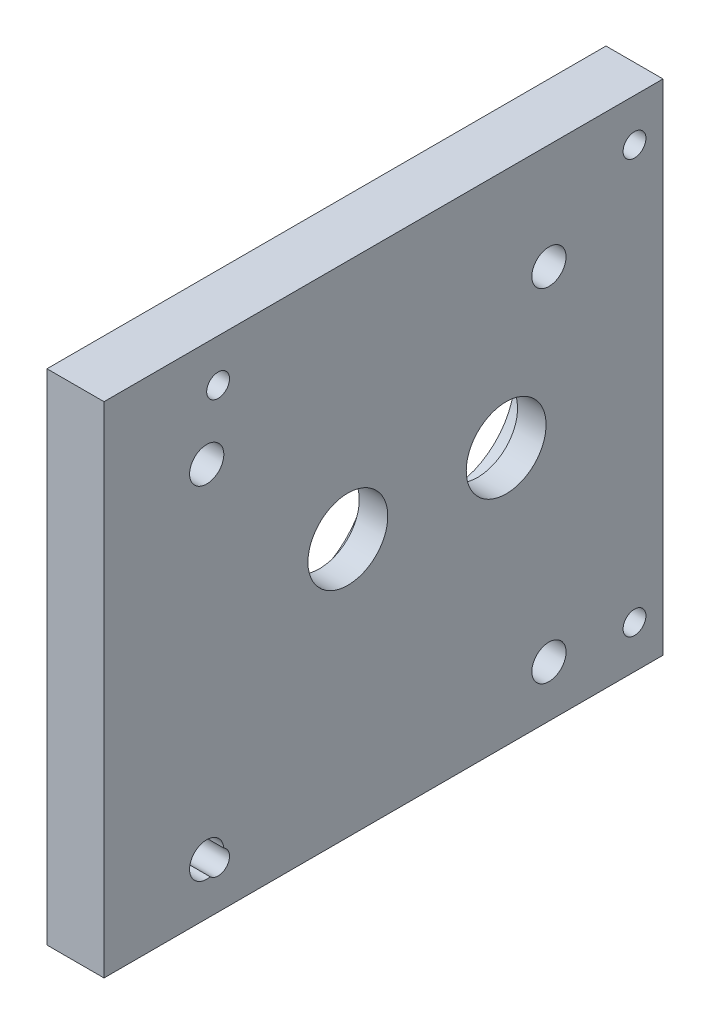
from build123d import *

# Parameters (mm, degrees)
SKETCH1_W           = 20
SKETCH1_H           = 196
BOSS_EXTRUDE1_DEPTH = 175
SKETCH2_R           = 27.5
SKETCH2_R_2         = 23
CUT_EXTRUDE1_DEPTH  = 10
SKETCH3_R           = 14
CUT_EXTRUDE2_DEPTH  = 201.820815654
SKETCH4_R           = 4
CUT_EXTRUDE3_DEPTH  = 202.566366242
SKETCH5_R           = 6
CUT_EXTRUDE4_DEPTH  = 202.566366242
SKETCH6_R           = 4
CUT_EXTRUDE6_DEPTH  = 12


with BuildPart() as part:
    # Sketch1 → Boss-Extrude1 (new body)
    with BuildSketch(Plane(origin=(114, 0, 0), x_dir=(1, 0, 0), z_dir=(0, 1, 0))):
        with Locations((-114, 0)):
            Rectangle(SKETCH1_W, SKETCH1_H)
    extrude(amount=BOSS_EXTRUDE1_DEPTH)

    # Sketch2 → Cut-Extrude1 (cut)
    with BuildSketch(Plane.ZY.offset(10)):
        with Locations((12.5, 90.5)):
            Circle(SKETCH2_R)
        with Locations((-43, 90.5)):
            Circle(SKETCH2_R_2)
    extrude(amount=-CUT_EXTRUDE1_DEPTH, mode=Mode.SUBTRACT)

    # Sketch3 → Cut-Extrude2 (cut, through all)
    with BuildSketch(Plane.ZY):
        with Locations((12.5, 90.5)):
            Circle(SKETCH3_R)
        with Locations((-43, 90.5)):
            Circle(SKETCH3_R)
    extrude(amount=-CUT_EXTRUDE2_DEPTH, mode=Mode.SUBTRACT)

    # Sketch4 → Cut-Extrude3 (cut, through all)
    with BuildSketch(Plane.ZY.offset(10)):
        with Locations((58, 15)):
            Circle(SKETCH4_R)
        with Locations((-88, 15)):
            Circle(SKETCH4_R)
        with Locations((-88, 160)):
            Circle(SKETCH4_R)
        with Locations((58, 160)):
            Circle(SKETCH4_R)
    extrude(amount=-CUT_EXTRUDE3_DEPTH, mode=Mode.SUBTRACT)

    # Sketch5 → Cut-Extrude4 (cut, through all)
    with BuildSketch(Plane.ZY.offset(10)):
        with Locations((62, 138)):
            Circle(SKETCH5_R)
        with Locations((62, 18)):
            Circle(SKETCH5_R)
        with Locations((-58, 138)):
            Circle(SKETCH5_R)
        with Locations((-58, 18)):
            Circle(SKETCH5_R)
    extrude(amount=-CUT_EXTRUDE4_DEPTH, mode=Mode.SUBTRACT)

    # Sketch6 → Cut-Extrude6 (cut)
    with BuildSketch(Plane.XZ):
        with Locations((0, -65)):
            Circle(SKETCH6_R)
        with Locations((0, 35)):
            Circle(SKETCH6_R)
    extrude(amount=-CUT_EXTRUDE6_DEPTH, mode=Mode.SUBTRACT)


solid = part.part
